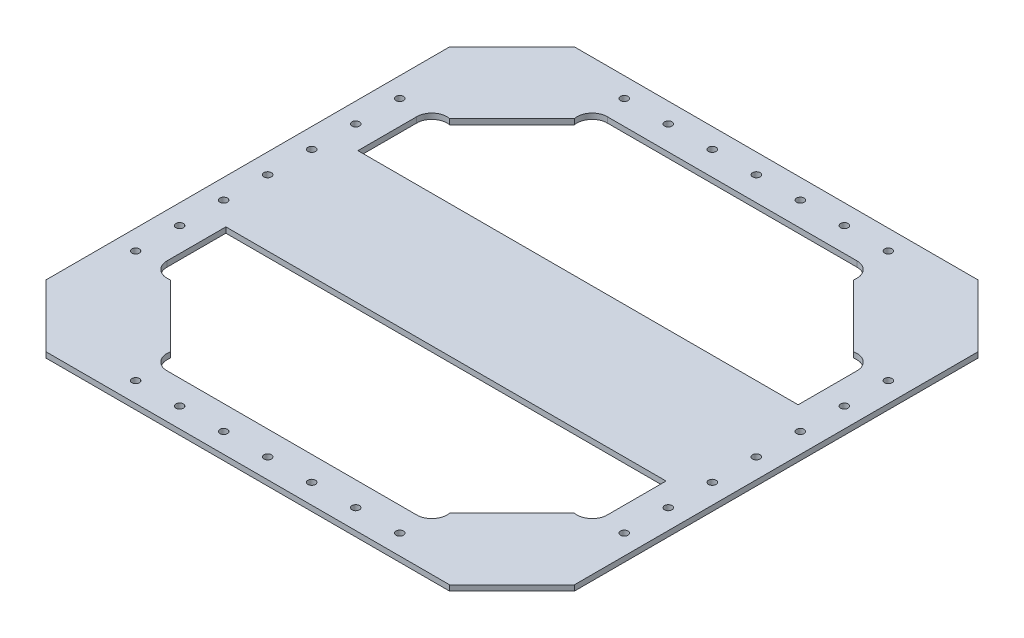
from build123d import *

# Parameters (mm, degrees)
BOSS_EXTRUDE1_DEPTH = 3.175
CUT_EXTRUDE1_DEPTH  = 252.960239461
BOSS_EXTRUDE2_DEPTH = 3.175
SKETCH4_R           = 2.159
CUT_EXTRUDE2_DEPTH  = 252.960239461


with BuildPart() as part:
    # Sketch1 → Boss-Extrude1 (new body)
    with BuildSketch(Plane(origin=(0, 0, 0), x_dir=(1, 0, 0), z_dir=(0, 1, 0))):
        Polygon((-152.4, 68.259630377), (-116.478975516, 104.180654861), (116.478975516, 104.180654861), (152.4, 68.259630377), (152.4, -164.698320655), (116.478975516, -200.619345139), (-116.478975516, -200.619345139), (-152.4, -164.698320655), align=None)
    extrude(amount=BOSS_EXTRUDE1_DEPTH)

    # Sketch2 → Cut-Extrude1 (cut, through all)
    with BuildSketch(Plane(origin=(0, 3.175, 0), x_dir=(1, 0, 0), z_dir=(0, 1, 0))):
        Polygon((-91.078975516, 78.780654861), (91.078975516, 78.780654861), (127, 42.859630377), (127, -10.119345139), (82.442975516, -10.119345139), (-74.314975516, -10.119345139), (-127, -10.119345139), (-127, 42.859630377), align=None)
        Polygon((127, -139.298320655), (91.078975516, -175.219345139), (-91.078975516, -175.219345139), (-127, -139.298320655), (-127, -86.319345139), (-74.314975516, -86.319345139), (82.442975516, -86.319345139), (127, -86.319345139), align=None)
    extrude(amount=-CUT_EXTRUDE1_DEPTH, mode=Mode.SUBTRACT)

    # Sketch5 → Boss-Extrude2 (add)
    with BuildSketch(Plane(origin=(0, 3.175, 0), x_dir=(1, 0, 0), z_dir=(0, 1, 0))):
        with BuildLine():
            Line((-116.478975516, 32.338605892), (-80.557951031, 68.259630377))
            ThreePointArc((-80.557951031, 68.259630377), (-78.800891411, 75.552814743), (-72.028975516, 78.780654861))
            Line((-72.028975516, 78.780654861), (-59.328975516, 78.780654861))
            Line((-59.328975516, 78.780654861), (-59.328975516, 104.180654861))
            Line((-59.328975516, 104.180654861), (-116.478975516, 104.180654861))
            Line((-116.478975516, 104.180654861), (-152.4, 68.259630377))
            Line((-152.4, 68.259630377), (-152.4, 11.109630377))
            Line((-152.4, 11.109630377), (-127, 11.109630377))
            Line((-127, 11.109630377), (-127, 23.809630377))
            ThreePointArc((-127, 23.809630377), (-123.772159882, 30.581546271), (-116.478975516, 32.338605892))
        make_face()
        with BuildLine():
            Line((127, 11.109630377), (127, 23.809630377))
            ThreePointArc((127, 23.809630377), (123.772159882, 30.581546271), (116.478975516, 32.338605892))
            Line((116.478975516, 32.338605892), (80.557951031, 68.259630377))
            ThreePointArc((80.557951031, 68.259630377), (78.800891411, 75.552814743), (72.028975516, 78.780654861))
            Line((72.028975516, 78.780654861), (59.328975516, 78.780654861))
            Line((59.328975516, 78.780654861), (59.328975516, 104.180654861))
            Line((59.328975516, 104.180654861), (116.478975516, 104.180654861))
            Line((116.478975516, 104.180654861), (152.4, 68.259630377))
            Line((152.4, 68.259630377), (152.4, 11.109630377))
            Line((152.4, 11.109630377), (127, 11.109630377))
        make_face()
        with BuildLine():
            Line((116.478975516, -128.777296171), (80.557951031, -164.698320655))
            ThreePointArc((80.557951031, -164.698320655), (78.800891411, -171.991505021), (72.028975516, -175.219345139))
            Line((72.028975516, -175.219345139), (59.328975516, -175.219345139))
            Line((59.328975516, -175.219345139), (59.328975516, -200.619345139))
            Line((59.328975516, -200.619345139), (116.478975516, -200.619345139))
            Line((116.478975516, -200.619345139), (152.4, -164.698320655))
            Line((152.4, -164.698320655), (152.4, -107.548320655))
            Line((152.4, -107.548320655), (127, -107.548320655))
            Line((127, -107.548320655), (127, -120.248320655))
            ThreePointArc((127, -120.248320655), (123.772159882, -127.02023655), (116.478975516, -128.777296171))
        make_face()
        with BuildLine():
            Line((-127, -107.548320655), (-127, -120.248320655))
            ThreePointArc((-127, -120.248320655), (-123.772159882, -127.02023655), (-116.478975516, -128.777296171))
            Line((-116.478975516, -128.777296171), (-80.557951031, -164.698320655))
            ThreePointArc((-80.557951031, -164.698320655), (-78.800891411, -171.991505021), (-72.028975516, -175.219345139))
            Line((-72.028975516, -175.219345139), (-59.328975516, -175.219345139))
            Line((-59.328975516, -175.219345139), (-59.328975516, -200.619345139))
            Line((-59.328975516, -200.619345139), (-116.478975516, -200.619345139))
            Line((-116.478975516, -200.619345139), (-152.4, -164.698320655))
            Line((-152.4, -164.698320655), (-152.4, -107.548320655))
            Line((-152.4, -107.548320655), (-127, -107.548320655))
        make_face()
    extrude(amount=-BOSS_EXTRUDE2_DEPTH)

    # Sketch4 → Cut-Extrude2 (cut, through all)
    with BuildSketch(Plane(origin=(0, 3.175, 0), x_dir=(1, 0, 0), z_dir=(0, 1, 0))):
        with Locations((0, 92.750654861)):
            Circle(SKETCH4_R)
        with Locations((-50.8, 92.750654861)):
            Circle(SKETCH4_R)
        with Locations((50.8, 92.750654861)):
            Circle(SKETCH4_R)
        with Locations((-25.4, 92.750654861)):
            Circle(SKETCH4_R)
        with Locations((25.4, 92.750654861)):
            Circle(SKETCH4_R)
        with Locations((-140.97, -48.219345139)):
            Circle(SKETCH4_R)
        with Locations((-140.97, -22.819345139)):
            Circle(SKETCH4_R)
        with Locations((-140.97, 2.580654861)):
            Circle(SKETCH4_R)
        with Locations((140.97, -48.219345139)):
            Circle(SKETCH4_R)
        with Locations((140.97, -22.819345139)):
            Circle(SKETCH4_R)
        with Locations((140.97, 2.580654861)):
            Circle(SKETCH4_R)
        with Locations((140.97, -99.019345139)):
            Circle(SKETCH4_R)
        with Locations((140.97, -73.619345139)):
            Circle(SKETCH4_R)
        with Locations((-140.97, -99.019345139)):
            Circle(SKETCH4_R)
        with Locations((-140.97, -73.619345139)):
            Circle(SKETCH4_R)
        with Locations((25.4, -189.189345139)):
            Circle(SKETCH4_R)
        with Locations((-25.4, -189.189345139)):
            Circle(SKETCH4_R)
        with Locations((50.8, -189.189345139)):
            Circle(SKETCH4_R)
        with Locations((-50.8, -189.189345139)):
            Circle(SKETCH4_R)
        with Locations((0, -189.189345139)):
            Circle(SKETCH4_R)
        with Locations((-76.2, 92.750654861)):
            Circle(SKETCH4_R)
        with Locations((76.2, 92.750654861)):
            Circle(SKETCH4_R)
        with Locations((-140.97, 27.980654861)):
            Circle(SKETCH4_R)
        with Locations((140.97, 27.980654861)):
            Circle(SKETCH4_R)
        with Locations((140.97, -124.419345139)):
            Circle(SKETCH4_R)
        with Locations((76.2, -189.189345139)):
            Circle(SKETCH4_R)
        with Locations((-76.2, -189.189345139)):
            Circle(SKETCH4_R)
        with Locations((-140.97, -124.419345139)):
            Circle(SKETCH4_R)
    extrude(amount=-CUT_EXTRUDE2_DEPTH, mode=Mode.SUBTRACT)


solid = part.part
